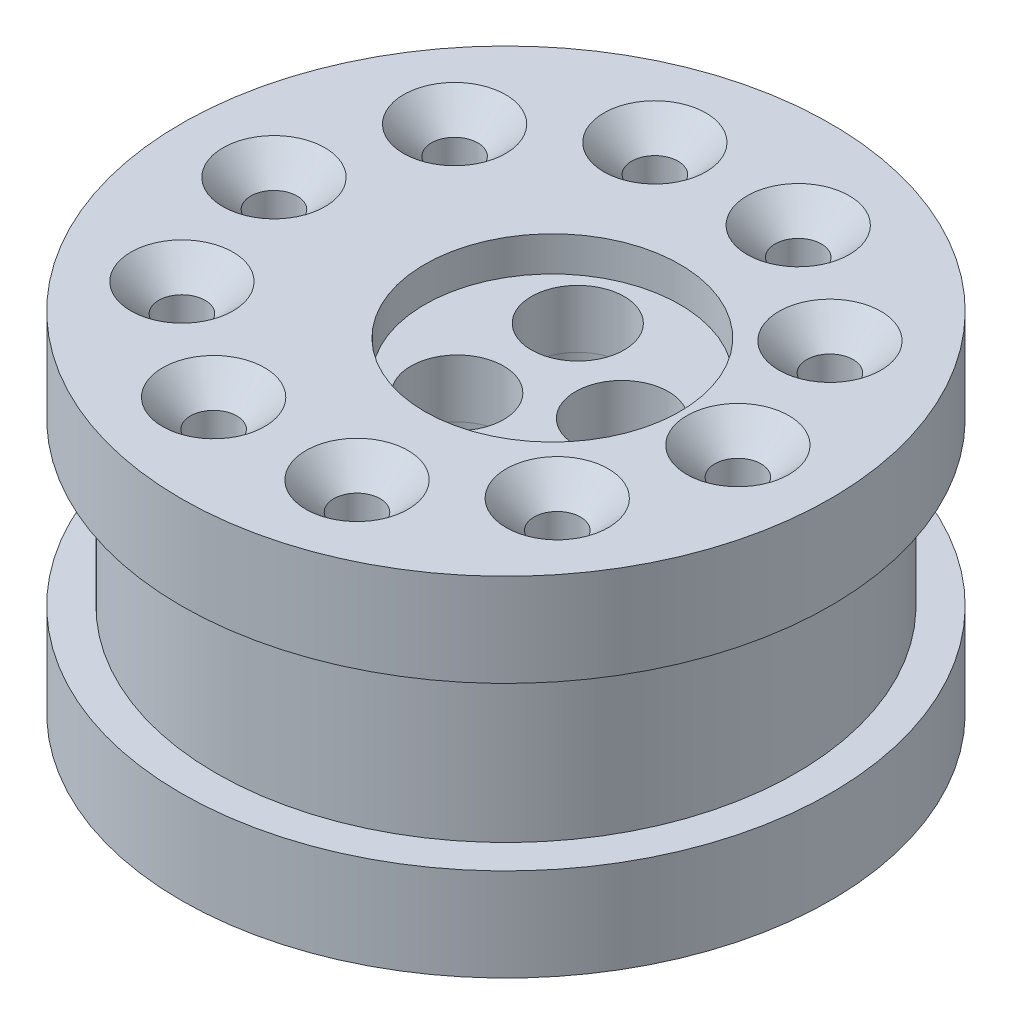
from build123d import *

# Parameters (mm, degrees)
SKETCH1_R               = 12.5
BOSS_EXTRUDE1_DEPTH     = 7
SKETCH2_R               = 14
BOSS_EXTRUDE2_DEPTH     = 4
SKETCH3_R               = 14
BOSS_EXTRUDE3_DEPTH     = 4
SKETCH4_R               = 1
CUT_EXTRUDE1_DEPTH      = 6
SKETCH6_R               = 1.75
CUT_EXTRUDE2_DEPTH      = 3
CHAMFER1_SIZE           = 1.2
CHAMFER2_SIZE           = 1.2
CUT_EXTRUDE4_DEPTH      = 25.839484697
CUT_EXTRUDE4_DEPTH_BACK = 25.839484697
SKETCH7_R               = 2
SKETCH8_R               = 5.5
CUT_EXTRUDE5_DEPTH      = 1.5
SKETCH9_R               = 5.5
SKETCH9_R_2             = 2
BOSS_EXTRUDE4_DEPTH     = 3
SKETCH10_R              = 5.5
CUT_EXTRUDE6_DEPTH      = 1.5


# Read off the part's stored shape, not the designer's step: Intersect1
with BuildPart() as part:
    # Sketch1 → Boss-Extrude1 (new body)
    with BuildSketch(Plane(origin=(0, 0, 0), x_dir=(1, 0, 0), z_dir=(0, 1, 0))):
        with Locations(Location((0, 0, 0), (0, 0, 270))):
            Circle(SKETCH1_R)
    extrude(amount=BOSS_EXTRUDE1_DEPTH)

    # Sketch3 → Boss-Extrude3 (add)
    with BuildSketch(Plane.XZ):
        with Locations(Location((0, 0, 0), (0, 0, 90))):
            Circle(SKETCH3_R)
    extrude(amount=BOSS_EXTRUDE3_DEPTH)


with BuildPart() as body_2:
    # Sketch2 → Boss-Extrude2 (new body)
    with BuildSketch(Plane(origin=(0, 7, 0), x_dir=(1, 0, 0), z_dir=(0, 1, 0))):
        with Locations(Location((0, 0, 0), (0, 0, 270))):
            Circle(SKETCH2_R)
    extrude(amount=BOSS_EXTRUDE2_DEPTH)


with BuildPart() as cut_extrude1_tool:
    # Sketch4 → Cut-Extrude1 (new body)
    with BuildSketch(Plane(origin=(0, 11, 0), x_dir=(1, 0, 0), z_dir=(0, 1, 0))):
        with Locations(Location((10, 0, 0), (0, 0, 270))):
            Circle(SKETCH4_R)
        with Locations(Location((8.090169944, -5.877852523, 0), (0, 0, 270))):
            Circle(SKETCH4_R)
        with Locations(Location((3.090169944, -9.510565163, 0), (0, 0, 270))):
            Circle(SKETCH4_R)
        with Locations(Location((-3.090169944, -9.510565163, 0), (0, 0, 270))):
            Circle(SKETCH4_R)
        with Locations(Location((-8.090169944, -5.877852523, 0), (0, 0, 270))):
            Circle(SKETCH4_R)
        with Locations(Location((-10, 0, 0), (0, 0, 270))):
            Circle(SKETCH4_R)
        with Locations(Location((-8.090169944, 5.877852523, 0), (0, 0, 270))):
            Circle(SKETCH4_R)
        with Locations(Location((-3.090169944, 9.510565163, 0), (0, 0, 270))):
            Circle(SKETCH4_R)
        with Locations(Location((3.090169944, 9.510565163, 0), (0, 0, 270))):
            Circle(SKETCH4_R)
        with Locations(Location((8.090169944, 5.877852523, 0), (0, 0, 270))):
            Circle(SKETCH4_R)
    extrude(amount=-CUT_EXTRUDE1_DEPTH)


with BuildPart() as part_1:
    add(part.part)

    # Cut-Extrude1: cut by cut_extrude1_tool
    add(cut_extrude1_tool.part, mode=Mode.SUBTRACT)


with BuildPart() as body_2_1:
    add(body_2.part)

    # Cut-Extrude1: cut by cut_extrude1_tool
    add(cut_extrude1_tool.part, mode=Mode.SUBTRACT)


with BuildPart() as body_3:
    # Intersect1: the piece on the far side of the plane
    add(part_1.part)
    split(bisect_by=Plane(origin=(0, 0, 0), x_dir=(1, 0, 0), z_dir=(0, 1, 0)), keep=Keep.BOTTOM)


with BuildPart() as part_2:
    add(part_1.part)

    # Intersect1
    split(bisect_by=Plane(origin=(0, 0, 0), x_dir=(1, 0, 0), z_dir=(0, 1, 0)), keep=Keep.TOP)

    # Sketch6 → Cut-Extrude2 (cut)
    with BuildSketch(Plane(origin=(0, 7, 0), x_dir=(1, 0, 0), z_dir=(0, 1, 0))):
        with Locations(Location((-10, 0, 0), (0, 0, 270))):
            Circle(SKETCH6_R)
        with Locations(Location((-8.090169944, 5.877852523, 0), (0, 0, 270))):
            Circle(SKETCH6_R)
        with Locations(Location((-3.090169944, 9.510565163, 0), (0, 0, 270))):
            Circle(SKETCH6_R)
        with Locations(Location((3.090169944, 9.510565163, 0), (0, 0, 270))):
            Circle(SKETCH6_R)
        with Locations(Location((8.090169944, 5.877852523, 0), (0, 0, 270))):
            Circle(SKETCH6_R)
        with Locations(Location((10, 0, 0), (0, 0, 270))):
            Circle(SKETCH6_R)
        with Locations(Location((8.090169944, -5.877852523, 0), (0, 0, 270))):
            Circle(SKETCH6_R)
        with Locations(Location((3.090169944, -9.510565163, 0), (0, 0, 270))):
            Circle(SKETCH6_R)
        with Locations(Location((-3.090169944, -9.510565163, 0), (0, 0, 270))):
            Circle(SKETCH6_R)
        with Locations(Location((-8.090169944, -5.877852523, 0), (0, 0, 270))):
            Circle(SKETCH6_R)
    cut_extrude2 = extrude(amount=-CUT_EXTRUDE2_DEPTH, mode=Mode.SUBTRACT)

    # Mirror2: Cut-Extrude2 across plane
    add(cut_extrude2.mirror(Plane.ZX.offset(3.5)), mode=Mode.SUBTRACT)


with BuildPart() as body_3_2:
    # Mirror1: mirrored copy
    add(body_2_1.part.mirror(Plane.ZX.offset(3.5)))


with BuildPart() as body_3_3:
    # Mirror3: mirrored copy
    add(body_2_1.part.mirror(Plane.ZX.offset(3.5)))

    # Chamfer2
    chamfer2_edges = [body_3_3.edges().sort_by_distance(p)[0] for p in [
        (-8.090169944, -4, 4.877852523),
        (-10, -4, -1),
        (-8.090169944, -4, -6.877852523),
        (-3.090169944, -4, -10.510565163),
        (3.090169944, -4, -10.510565163),
        (8.090169944, -4, -6.877852523),
        (10, -4, -1),
        (8.090169944, -4, 4.877852523),
        (3.090169944, -4, 8.510565163),
        (-3.090169944, -4, 8.510565163),
    ]]
    chamfer(chamfer2_edges, length=CHAMFER2_SIZE)


with BuildPart() as body_2_2:
    add(body_2_1.part)

    # Chamfer1
    chamfer1_edges = [body_2_2.edges().sort_by_distance(p)[0] for p in [
        (-8.090169944, 11, 4.877852523),
        (-10, 11, -1),
        (-8.090169944, 11, -6.877852523),
        (-3.090169944, 11, -10.510565163),
        (3.090169944, 11, -10.510565163),
        (8.090169944, 11, -6.877852523),
        (10, 11, -1),
        (8.090169944, 11, 4.877852523),
        (3.090169944, 11, 8.510565163),
        (-3.090169944, 11, 8.510565163),
    ]]
    chamfer(chamfer1_edges, length=CHAMFER1_SIZE)


with BuildPart() as cut_extrude4_tool:
    # Sketch7 → Cut-Extrude4 (new, two sides: drawn at the far end of the back side and taken through both)
    with BuildSketch(Plane(origin=(0, 11, 0), x_dir=(1, 0, 0), z_dir=(0, 1, 0)).offset(-CUT_EXTRUDE4_DEPTH_BACK)):
        with Locations(Location((5, 0, 0), (0, 0, 270))):
            Circle(SKETCH7_R)
        with Locations(Location((0.5, -2.598076211, 0), (0, 0, 270))):
            Circle(SKETCH7_R)
        with Locations(Location((0.5, 2.598076211, 0), (0, 0, 270))):
            Circle(SKETCH7_R)
    extrude(amount=CUT_EXTRUDE4_DEPTH + CUT_EXTRUDE4_DEPTH_BACK)


with BuildPart() as part_3:
    add(part_2.part)

    # Cut-Extrude4: cut by cut_extrude4_tool
    add(cut_extrude4_tool.part, mode=Mode.SUBTRACT)


with BuildPart() as body_2_3:
    add(body_2_2.part)

    # Cut-Extrude4: cut by cut_extrude4_tool
    add(cut_extrude4_tool.part, mode=Mode.SUBTRACT)

    # Sketch8 → Cut-Extrude5 (cut)
    with BuildSketch(Plane(origin=(0, 11, 0), x_dir=(1, 0, 0), z_dir=(0, 1, 0))):
        with Locations(Location((2, 0, 0), (0, 0, 270))):
            Circle(SKETCH8_R)
    extrude(amount=-CUT_EXTRUDE5_DEPTH, mode=Mode.SUBTRACT)


with BuildPart() as body_3_3_1:
    add(body_3_3.part)

    # Cut-Extrude4: cut by cut_extrude4_tool
    add(cut_extrude4_tool.part, mode=Mode.SUBTRACT)

    # Sketch10 → Cut-Extrude6 (cut)
    with BuildSketch(Plane.XZ.offset(4)):
        with Locations(Location((2, 0, 0), (0, 0, 270))):
            Circle(SKETCH10_R)
    extrude(amount=-CUT_EXTRUDE6_DEPTH, mode=Mode.SUBTRACT)


with BuildPart() as body_4:
    # Sketch9 → Boss-Extrude4 (new body)
    with BuildSketch(Plane(origin=(0, 9.5, 0), x_dir=(1, 0, 0), z_dir=(0, 1, 0))):
        with Locations(Location((2, 0, 0), (0, 0, 270))):
            Circle(SKETCH9_R)
        with Locations(Location((5, 0, 0), (0, 0, 270))):
            Circle(SKETCH9_R_2, mode=Mode.SUBTRACT)
        with Locations(Location((0.5, -2.598076211, 0), (0, 0, 270))):
            Circle(SKETCH9_R_2, mode=Mode.SUBTRACT)
        with Locations(Location((0.5, 2.598076211, 0), (0, 0, 270))):
            Circle(SKETCH9_R_2, mode=Mode.SUBTRACT)
    extrude(amount=BOSS_EXTRUDE4_DEPTH)


solid = Compound([part_3.part, body_2_3.part, body_3_3_1.part])
